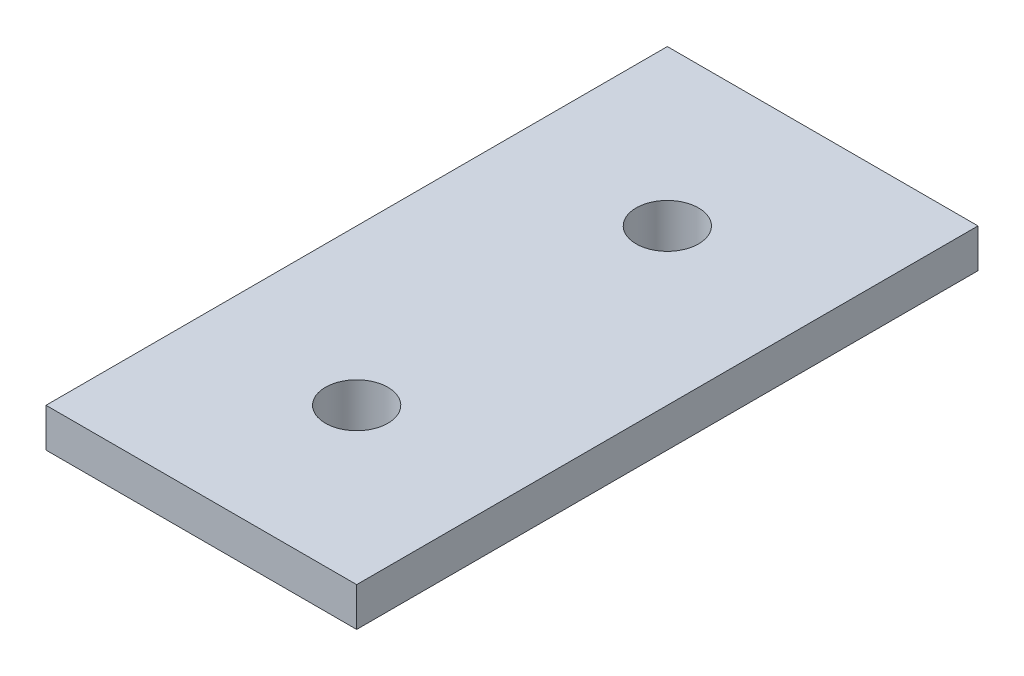
from build123d import *

# Parameters (mm, degrees)
SKETCH1_W           = 21.717
SKETCH1_H           = 47.117
BOSS_EXTRUDE1_DEPTH = 0.762
SKETCH2_W           = 25.4
SKETCH2_H           = 50.8
BOSS_EXTRUDE2_DEPTH = 3.175
SKETCH3_R           = 2.5527
CUT_EXTRUDE1_DEPTH  = 29.669669845


with BuildPart() as part:
    # Sketch1 → Boss-Extrude1 (new body)
    with BuildSketch(Plane(origin=(0, 0, 0), x_dir=(1, 0, 0), z_dir=(0, 1, 0))):
        Rectangle(SKETCH1_W, SKETCH1_H)
    extrude(amount=BOSS_EXTRUDE1_DEPTH)

    # Sketch2 → Boss-Extrude2 (add)
    with BuildSketch(Plane(origin=(0, 0.762, 0), x_dir=(1, 0, 0), z_dir=(0, 1, 0))):
        Rectangle(SKETCH2_W, SKETCH2_H)
    extrude(amount=BOSS_EXTRUDE2_DEPTH)

    # Sketch3 → Cut-Extrude1 (cut, through all)
    with BuildSketch(Plane(origin=(0, 3.937, 0), x_dir=(1, 0, 0), z_dir=(0, 1, 0))):
        with Locations((0, 12.7)):
            Circle(SKETCH3_R)
        with Locations((0, -12.7)):
            Circle(SKETCH3_R)
    extrude(amount=-CUT_EXTRUDE1_DEPTH, mode=Mode.SUBTRACT)


solid = part.part
